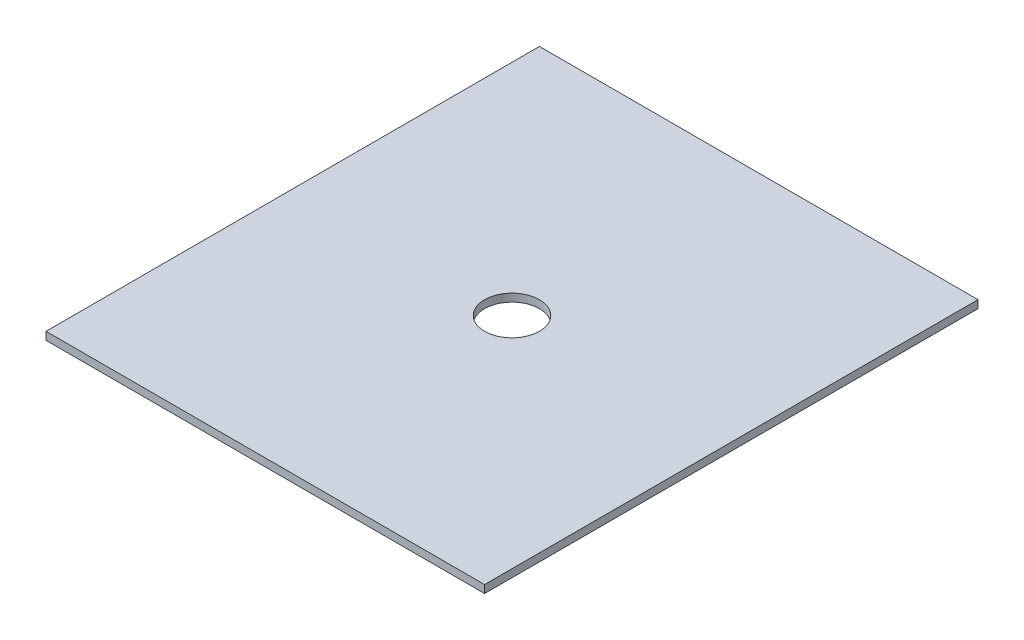
from build123d import *

# Parameters (mm, degrees)
SKETCH1_W           = 355.6
SKETCH1_H           = 400.05
SKETCH1_R           = 22.225
BOSS_EXTRUDE1_DEPTH = 6.35


with BuildPart() as part:
    # Sketch1 → Boss-Extrude1 (new body)
    with BuildSketch(Plane(origin=(0, 0, 0), x_dir=(1, 0, 0), z_dir=(0, 1, 0))):
        with Locations((177.8, 200.025)):
            Rectangle(SKETCH1_W, SKETCH1_H)
        with Locations((177.8, 200.025)):
            Circle(SKETCH1_R, mode=Mode.SUBTRACT)
    extrude(amount=BOSS_EXTRUDE1_DEPTH)


solid = part.part
